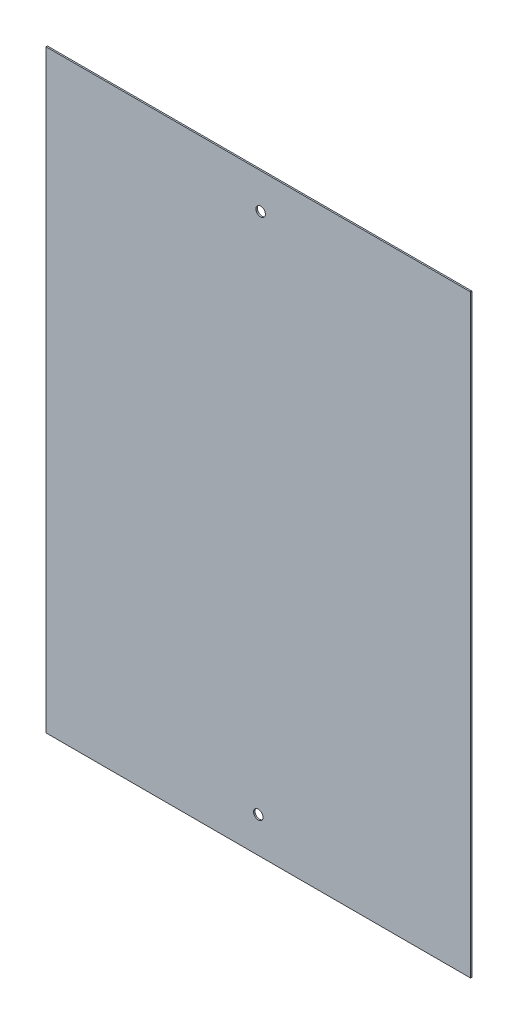
from build123d import *

# Parameters (mm, degrees)
SKETCH1_R             = 2
BASE_FLANGE1_DEPTH    = 0.6
DELETEFACE1_START     = -0.6
DELETEFACE1_OUTLINE_W = 10
DELETEFACE1_OUTLINE_H = 67
DELETEFACE1_DEPTH     = 0.6


with BuildPart() as part:
    # Base-Flange1: sheet metal written as solids
    # Sketch1 → Base-Flange1 (new body)
    with BuildSketch(Plane.XY):
        Polygon((80.230971718, 126.115950591), (-79.769028282, 126.115950591), (-79.769028282, 59.115950591), (-89.769028282, 59.115950591), (-89.769028282, -125.884049409), (90.230971718, -125.884049409), (90.230971718, 59.115950591), (80.230971718, 59.115950591), align=None)
        with Locations((1.24782761, 111.115950591)):
            Circle(SKETCH1_R, mode=Mode.SUBTRACT)
        with Locations((0.230971718, -110.884049409)):
            Circle(SKETCH1_R, mode=Mode.SUBTRACT)
    extrude(amount=-BASE_FLANGE1_DEPTH)

    # DeleteFace1: read off the stored shape, not the designer's step
    # DeleteFace1 outline → DeleteFace1 (add)
    with BuildSketch(Plane.XY.offset(DELETEFACE1_START)):
        with Locations((85.230971718, 92.615950591)):
            Rectangle(DELETEFACE1_OUTLINE_W, DELETEFACE1_OUTLINE_H)
        with Locations((-84.769028282, 92.615950591)):
            Rectangle(DELETEFACE1_OUTLINE_W, DELETEFACE1_OUTLINE_H)
    extrude(amount=DELETEFACE1_DEPTH)


solid = part.part
